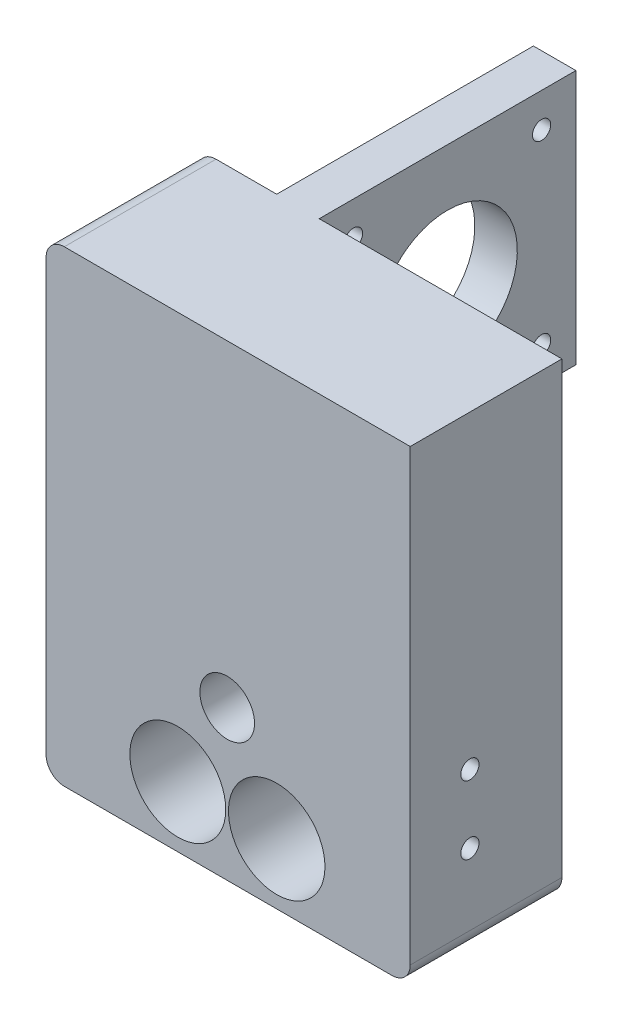
from build123d import *

# Parameters (mm, degrees)
ESQUISSE1_W              = 100
ESQUISSE1_H              = 100
BOSS_EXTRU_1_DEPTH       = 25
ESQUISSE2_R              = 7.9
ESQUISSE2_R_2            = 7.95
ESQUISSE2_R_3            = 4.5
ENL_V_MAT_EXTRU_1_DEPTH  = 144.614066163
ESQUISSE3_R              = 4.3
ENL_V_MAT_EXTRU_3_DEPTH  = 10
ESQUISSE4_W              = 7
ESQUISSE4_H              = 42
BOSS_EXTRU_2_DEPTH       = 42.3
ESQUISSE5_R              = 1.5
ENL_V_MAT_EXTRU_4_DEPTH  = 12
ESQUISSE6_W              = 40
ESQUISSE6_H              = 100
ENL_V_MAT_EXTRU_6_DEPTH  = 148.61195751
ENL_V_MAT_EXTRU_8_DEPTH  = 7.5
ESQUISSE9_W              = 60
ESQUISSE9_H              = 23
ENL_V_MAT_EXTRU_9_DEPTH  = 148.61195751
CONG_2_R                 = 3
ESQUISSE10_R             = 11.5
ENL_V_MAT_EXTRU_10_DEPTH = 100.635786744
ESQUISSE11_R             = 1.5
ENL_V_MAT_EXTRU_11_DEPTH = 3


with BuildPart() as part:
    # Esquisse1 → Boss.-Extru.1 (new body)
    with BuildSketch(Plane.XY):
        with Locations((50, 50)):
            Rectangle(ESQUISSE1_W, ESQUISSE1_H)
    extrude(amount=BOSS_EXTRU_1_DEPTH)

    # Esquisse2 → Enlèv. mat.-Extru.1 (cut, through all)
    with BuildSketch(Plane.XY):
        with Locations((61.7000009, 9.994583957)):
            Circle(ESQUISSE2_R)
        with Locations((78, 10)):
            Circle(ESQUISSE2_R_2)
        with Locations((69.845134328, 24.642259589)):
            Circle(ESQUISSE2_R_3)
    extrude(amount=ENL_V_MAT_EXTRU_1_DEPTH, mode=Mode.SUBTRACT)

    # Esquisse3 → Enlèv. mat.-Extru.3 (cut)
    with BuildSketch(Plane(origin=(0, 0, 0), x_dir=(1, 0, 0), z_dir=(0, 1, 0))):
        with Locations((48, -12.5)):
            Circle(ESQUISSE3_R)
        with Locations((92, -12.5)):
            Circle(ESQUISSE3_R)
    extrude(amount=ENL_V_MAT_EXTRU_3_DEPTH, mode=Mode.SUBTRACT)

    # Esquisse4 → Boss.-Extru.2 (add)
    with BuildSketch(Plane.XY):
        with Locations((56.5, 56)):
            Rectangle(ESQUISSE4_W, ESQUISSE4_H)
    extrude(amount=-BOSS_EXTRU_2_DEPTH)

    # Esquisse5 → Enlèv. mat.-Extru.4 (cut)
    with BuildSketch(Plane(origin=(60, 0, 0), x_dir=(0, 0, -1), z_dir=(1, 0, 0))):
        with Locations((36.65, 71.35)):
            Circle(ESQUISSE5_R)
        with Locations((36.65, 40.65)):
            Circle(ESQUISSE5_R)
        with Locations((5.65, 40.65)):
            Circle(ESQUISSE5_R)
        with Locations((5.65, 71.35)):
            Circle(ESQUISSE5_R)
    extrude(amount=-ENL_V_MAT_EXTRU_4_DEPTH, mode=Mode.SUBTRACT)

    # Esquisse6 → Enlèv. mat.-Extru.6 (cut, through all)
    with BuildSketch(Plane.XY):
        with Locations((20, 50)):
            Rectangle(ESQUISSE6_W, ESQUISSE6_H)
    extrude(amount=ENL_V_MAT_EXTRU_6_DEPTH, mode=Mode.SUBTRACT)

    # Esquisse8 → Enlèv. mat.-Extru.8 (cut)
    with BuildSketch(Plane(origin=(0, 0, 0), x_dir=(-1, 0, 0), z_dir=(0, 0, -1))):
        Polygon((-62.690994399, 21.852704928), (-63.852239162, 29.44314918), (-71.006379091, 32.232703841), (-76.999274258, 27.43181425), (-75.838029495, 19.841369999), (-68.683889565, 17.051815338), align=None)
    extrude(amount=-ENL_V_MAT_EXTRU_8_DEPTH, mode=Mode.SUBTRACT)

    # Esquisse9 → Enlèv. mat.-Extru.9 (cut, through all)
    with BuildSketch(Plane(origin=(0, 0, 0), x_dir=(-1, 0, 0), z_dir=(0, 0, -1))):
        with Locations((-70, 88.5)):
            Rectangle(ESQUISSE9_W, ESQUISSE9_H)
    extrude(amount=-ENL_V_MAT_EXTRU_9_DEPTH, mode=Mode.SUBTRACT)

    # Congé2
    cong_2_edges = [part.edges().sort_by_distance(p)[0] for p in [
        (100, 0, 12.5),
        (40, 77, 12.5),
        (40, 0, 12.5),
    ]]
    fillet(cong_2_edges, radius=CONG_2_R)

    # Esquisse10 → Enlèv. mat.-Extru.10 (cut, through all)
    with BuildSketch(Plane.ZY.offset(-53)):
        with Locations((-21.15, 56.15)):
            Circle(ESQUISSE10_R)
    extrude(amount=-ENL_V_MAT_EXTRU_10_DEPTH, mode=Mode.SUBTRACT)

    # Esquisse11 → Enlèv. mat.-Extru.11 (cut)
    with BuildSketch(Plane(origin=(100, 0, 0), x_dir=(0, 0, -1), z_dir=(1, 0, 0))):
        with Locations((-15.163954836, 26)):
            Circle(ESQUISSE11_R)
        with Locations((-15.163954836, 14.75187619)):
            Circle(ESQUISSE11_R)
    extrude(amount=-ENL_V_MAT_EXTRU_11_DEPTH, mode=Mode.SUBTRACT)


solid = part.part
